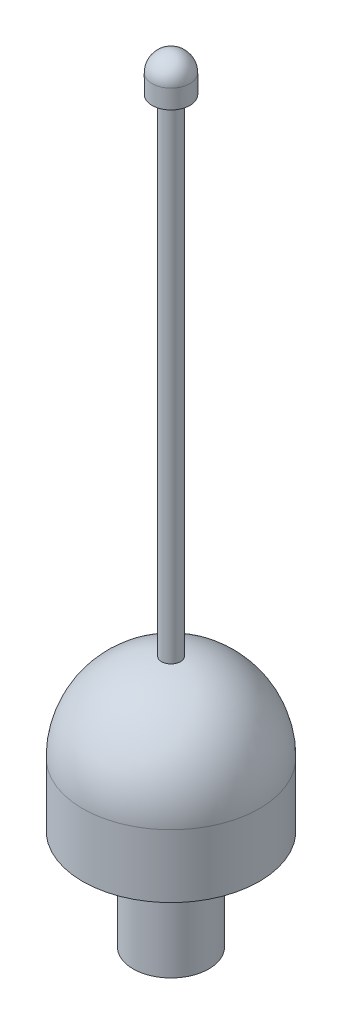
from build123d import *


with BuildPart() as part:
    # Sketch1 → Revolve1 (revolve)
    with BuildSketch(Plane.XY):
        with BuildLine():
            Line((0, 0), (1.905, 0))
            Line((1.905, 0), (1.905, 11.554556788))
            ThreePointArc((1.905, 11.554556788), (3.299556788, 10.16), (3.81, 8.255))
            Line((3.81, 8.255), (3.81, 5.08))
            Line((3.81, 5.08), (4.445, 5.08))
            Line((4.445, 5.08), (4.445, 8.255))
            ThreePointArc((4.445, 8.255), (3.307185832, 11.224940551), (0.47625, 12.674412963))
            Line((0.47625, 12.674412963), (0.47625, 37.1475))
            Line((0.47625, 37.1475), (0.9525, 37.1475))
            Line((0.9525, 37.1475), (0.9525, 38.1))
            ThreePointArc((0.9525, 38.1), (0.673519209, 38.773519209), (0, 39.0525))
            Line((0, 39.0525), (0, 0))
        make_face()
    revolve(axis=Axis((0, 39.0525, 0), (0, -1, 0)))


solid = part.part
